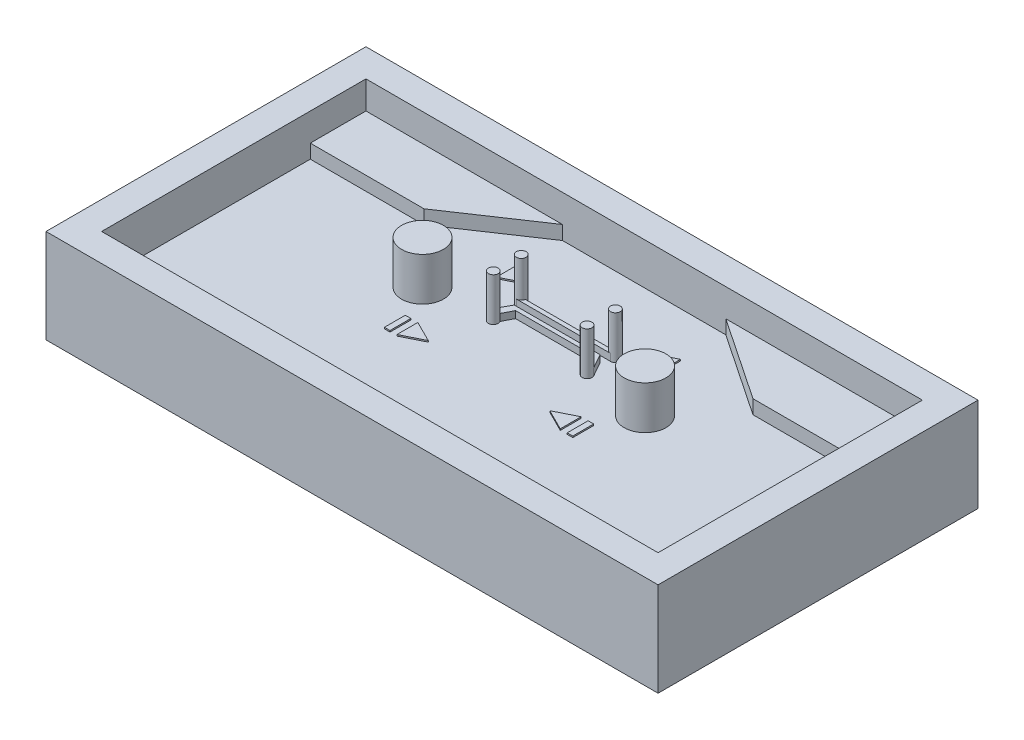
from build123d import *

# Parameters (mm, degrees)
SKETCH1_W           = 44
SKETCH1_H           = 23
BOSS_EXTRUDE1_DEPTH = 6
SKETCH2_W           = 44
SKETCH2_H           = 23
BOSS_EXTRUDE2_DEPTH = 0.75
CAVITY1_START       = 3
CAVITY1_OUTLINE_W   = 0.4
CAVITY1_OUTLINE_H   = 1.5
CAVITY1_OUTLINE_R   = 1.5
CAVITY1_DEPTH       = 3
CAVITY1_START_2     = 4
CAVITY1_2_OUTLINE_W = 0.4
CAVITY1_2_OUTLINE_H = 1.5
CAVITY1_2_DEPTH     = 2
CAVITY1_START_3     = 3.1
CAVITY1_3_OUTLINE_W = 0.4
CAVITY1_3_OUTLINE_H = 1.5
CAVITY1_3_DEPTH     = 0.9
CAVITY1_START_4     = 3.5
CAVITY1_4_DEPTH     = 0.5
SKETCH5_R           = 1.5
SKETCH5_R_2         = 0.35
BOSS_EXTRUDE3_DEPTH = 0.1


# Read off the part's stored shape, not the designer's step: Cavity1
with BuildPart() as part:
    # Sketch1 → Boss-Extrude1 (new body)
    with BuildSketch(Plane(origin=(0, 0, 0), x_dir=(1, 0, 0), z_dir=(0, 1, 0))):
        Rectangle(SKETCH1_W, SKETCH1_H)
    extrude(amount=BOSS_EXTRUDE1_DEPTH)

    # Sketch2 → Boss-Extrude2 (add)
    with BuildSketch(Plane.XZ):
        Rectangle(SKETCH2_W, SKETCH2_H)
    extrude(amount=BOSS_EXTRUDE2_DEPTH)

    # Cavity1 outline → Cavity1 (cut)
    with BuildSketch(Plane(origin=(0, 0, 0), x_dir=(1, 0, 0), z_dir=(0, 1, 0)).offset(CAVITY1_START)):
        Polygon((20, -9.5), (20, 5.5), (11.824003475, 5.5), (5.87, 9.5), (-5.87, 9.5), (-11.824003475, 5.5), (-20, 5.5), (-20, -9.5), align=None)
        with Locations((-6.57, -1.65)):
            Rectangle(CAVITY1_OUTLINE_W, CAVITY1_OUTLINE_H, mode=Mode.SUBTRACT)
        Polygon((-5.87, -2.4), (-5.87, -0.9), (-4.37, -1.65), align=None, mode=Mode.SUBTRACT)
        Polygon((4.37, -1.65), (5.87, -0.9), (5.87, -2.4), align=None, mode=Mode.SUBTRACT)
        with Locations((6.57, -1.65)):
            Rectangle(CAVITY1_OUTLINE_W, CAVITY1_OUTLINE_H, mode=Mode.SUBTRACT)
        with Locations((-8, 1.565)):
            Circle(CAVITY1_OUTLINE_R, mode=Mode.SUBTRACT)
        Polygon((-4.37, 5.5), (-5.87, 4.75), (-5.87, 6.25), align=None, mode=Mode.SUBTRACT)
        with Locations((8, 1.565)):
            Circle(CAVITY1_OUTLINE_R, mode=Mode.SUBTRACT)
        with BuildLine():
            ThreePointArc((-3.0745499, 2.214515103), (-3.36304333, 1.678756458), (-3.67597558, 2.200617734))
            Line((-3.67597558, 2.200617734), (-3.084051452, 3.25))
            Line((-3.084051452, 3.25), (3.084051452, 3.25))
            Line((3.084051452, 3.25), (3.67597558, 2.200617734))
            ThreePointArc((3.67597558, 2.200617734), (3.36304333, 1.678756458), (3.0745499, 2.214515103))
            Line((3.0745499, 2.214515103), (2.698000841, 2.95))
            Line((2.698000841, 2.95), (-2.698000841, 2.95))
            Line((-2.698000841, 2.95), (-3.0745499, 2.214515103))
        make_face(mode=Mode.SUBTRACT)
        with BuildLine():
            ThreePointArc((3.039420657, 4), (3.614959604, 4.314575131), (3.385830819, 3.7))
            Line((3.385830819, 3.7), (-3.385830819, 3.7))
            ThreePointArc((-3.385830819, 3.7), (-3.614959604, 4.314575131), (-3.039420657, 4))
            Line((-3.039420657, 4), (3.039420657, 4))
        make_face(mode=Mode.SUBTRACT)
        Polygon((4.37, 5.5), (5.87, 6.25), (5.87, 4.75), align=None, mode=Mode.SUBTRACT)
    extrude(amount=CAVITY1_DEPTH, mode=Mode.SUBTRACT)

    # Cavity1 2 outline → Cavity1 2 (cut)
    with BuildSketch(Plane(origin=(0, 0, 0), x_dir=(1, 0, 0), z_dir=(0, 1, 0)).offset(CAVITY1_START_2)):
        Polygon((20, 5.5), (20, 9.5), (5.87, 9.5), (11.824003475, 5.5), align=None)
        Polygon((-11.824003475, 5.5), (-5.87, 9.5), (-20, 9.5), (-20, 5.5), align=None)
        with BuildLine():
            ThreePointArc((3.385830819, 3.7), (3.156702034, 3.785424869), (3.039420657, 4))
            Line((3.039420657, 4), (-3.039420657, 4))
            ThreePointArc((-3.039420657, 4), (-3.156702034, 3.785424869), (-3.385830819, 3.7))
            Line((-3.385830819, 3.7), (3.385830819, 3.7))
        make_face()
        with BuildLine():
            ThreePointArc((-3.67597558, 2.200617734), (-3.379214176, 2.37856965), (-3.0745499, 2.214515103))
            Line((-3.0745499, 2.214515103), (-2.698000841, 2.95))
            Line((-2.698000841, 2.95), (2.698000841, 2.95))
            Line((2.698000841, 2.95), (3.0745499, 2.214515103))
            ThreePointArc((3.0745499, 2.214515103), (3.379214176, 2.37856965), (3.67597558, 2.200617734))
            Line((3.67597558, 2.200617734), (3.084051452, 3.25))
            Line((3.084051452, 3.25), (-3.084051452, 3.25))
            Line((-3.084051452, 3.25), (-3.67597558, 2.200617734))
        make_face()
        Polygon((5.87, 4.75), (5.87, 6.25), (4.37, 5.5), align=None)
        Polygon((5.87, -2.4), (5.87, -0.9), (4.37, -1.65), align=None)
        Polygon((-4.37, -1.65), (-5.87, -0.9), (-5.87, -2.4), align=None)
        Polygon((-5.87, 6.25), (-5.87, 4.75), (-4.37, 5.5), align=None)
        with Locations((-6.57, -1.65)):
            Rectangle(CAVITY1_2_OUTLINE_W, CAVITY1_2_OUTLINE_H)
        with Locations((6.57, -1.65)):
            Rectangle(CAVITY1_2_OUTLINE_W, CAVITY1_2_OUTLINE_H)
    extrude(amount=CAVITY1_2_DEPTH, mode=Mode.SUBTRACT)

    # Cavity1 3 outline → Cavity1 3 (cut)
    with BuildSketch(Plane(origin=(0, 0, 0), x_dir=(1, 0, 0), z_dir=(0, 1, 0)).offset(CAVITY1_START_3)):
        Polygon((5.87, 4.75), (5.87, 6.25), (4.37, 5.5), align=None)
        Polygon((5.87, -2.4), (5.87, -0.9), (4.37, -1.65), align=None)
        Polygon((-4.37, -1.65), (-5.87, -0.9), (-5.87, -2.4), align=None)
        Polygon((-5.87, 6.25), (-5.87, 4.75), (-4.37, 5.5), align=None)
        with Locations((-6.57, -1.65)):
            Rectangle(CAVITY1_3_OUTLINE_W, CAVITY1_3_OUTLINE_H)
        with Locations((6.57, -1.65)):
            Rectangle(CAVITY1_3_OUTLINE_W, CAVITY1_3_OUTLINE_H)
    extrude(amount=CAVITY1_3_DEPTH, mode=Mode.SUBTRACT)

    # Cavity1 4 outline → Cavity1 4 (cut)
    with BuildSketch(Plane(origin=(0, 0, 0), x_dir=(1, 0, 0), z_dir=(0, 1, 0)).offset(CAVITY1_START_4)):
        with BuildLine():
            ThreePointArc((3.385830819, 3.7), (3.156702034, 3.785424869), (3.039420657, 4))
            Line((3.039420657, 4), (-3.039420657, 4))
            ThreePointArc((-3.039420657, 4), (-3.156702034, 3.785424869), (-3.385830819, 3.7))
            Line((-3.385830819, 3.7), (3.385830819, 3.7))
        make_face()
        with BuildLine():
            ThreePointArc((-3.67597558, 2.200617734), (-3.379214176, 2.37856965), (-3.0745499, 2.214515103))
            Line((-3.0745499, 2.214515103), (-2.698000841, 2.95))
            Line((-2.698000841, 2.95), (2.698000841, 2.95))
            Line((2.698000841, 2.95), (3.0745499, 2.214515103))
            ThreePointArc((3.0745499, 2.214515103), (3.379214176, 2.37856965), (3.67597558, 2.200617734))
            Line((3.67597558, 2.200617734), (3.084051452, 3.25))
            Line((3.084051452, 3.25), (-3.084051452, 3.25))
            Line((-3.084051452, 3.25), (-3.67597558, 2.200617734))
        make_face()
    extrude(amount=CAVITY1_4_DEPTH, mode=Mode.SUBTRACT)

    # Sketch5 → Boss-Extrude3 (add)
    with BuildSketch(Plane(origin=(0, 6, 0), x_dir=(1, 0, 0), z_dir=(0, 1, 0))):
        with Locations(Location((-8, 1.565, 0), (0, 0, 270))):
            Circle(SKETCH5_R)
        with Locations(Location((8, 1.565, 0), (0, 0, 270))):
            Circle(SKETCH5_R)
        with Locations(Location((-3.385830819, 4.05, 0), (0, 0, 270))):
            Circle(SKETCH5_R_2)
        with Locations(Location((-3.371128753, 2.028663054, 0), (0, 0, 32.073441705))):
            Circle(SKETCH5_R_2)
        with Locations(Location((3.385830819, 4.05, 0), (0, 0, 270))):
            Circle(SKETCH5_R_2)
        with Locations(Location((3.371128753, 2.028663054, 0), (0, 0, 147.926558295))):
            Circle(SKETCH5_R_2)
    extrude(amount=BOSS_EXTRUDE3_DEPTH)


solid = part.part
